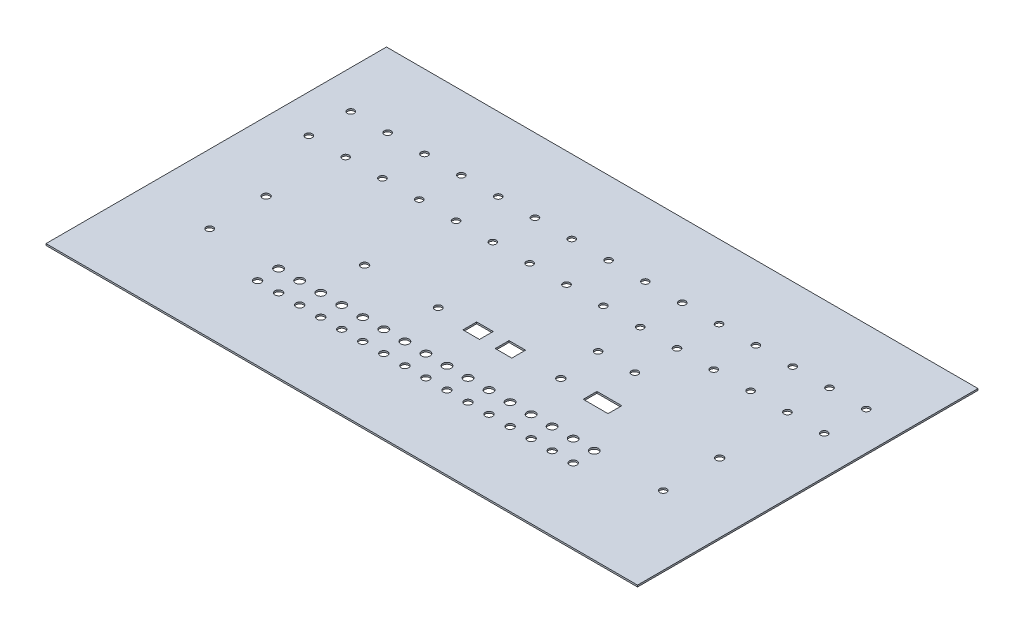
from build123d import *

# Parameters (mm, degrees)
SKETCH1_W            = 562.3
SKETCH1_H            = 323.65
BOSS_EXTRUDE1_DEPTH  = 1.5875
CUT_EXTRUDE1_REACH   = 326.4
SKETCH2_R            = 3.25
LPATTERN1_COUNT      = 15
LPATTERN1_PITCH      = 35
LPATTERN1_COUNT_DIR2 = 2
LPATTERN1_PITCH_DIR2 = 40
CUT_EXTRUDE2_REACH   = 326.4
SKETCH6_R            = 3.5
LPATTERN2_COUNT      = 16
LPATTERN2_PITCH      = 20
CUT_EXTRUDE3_REACH   = 326.4
SKETCH7_R            = 4
LPATTERN3_COUNT      = 16
LPATTERN3_PITCH      = 20
CUT_EXTRUDE4_REACH   = 326.4
SKETCH8_R            = 3.3
CUT_EXTRUDE5_REACH   = 326.4
SKETCH10_R           = 3.25
CUT_EXTRUDE6_REACH   = 326.4
SKETCH11_R           = 3.5
CUT_EXTRUDE7_REACH   = 326.4
SKETCH15_W           = 23.61
SKETCH15_H           = 13.08
CUT_EXTRUDE8_REACH   = 326.4
SKETCH16_R           = 3.3
CUT_EXTRUDE9_REACH   = 326.4
SKETCH18_W           = 15.74
SKETCH18_H           = 13.08
CUT_EXTRUDE10_REACH  = 326.4
SKETCH19_W           = 15.74
SKETCH19_H           = 13.08
CUT_EXTRUDE11_REACH  = 326.4
SKETCH22_R           = 3.5
CUT_EXTRUDE12_REACH  = 326.4
SKETCH24_R           = 3.5
CUT_EXTRUDE13_REACH  = 326.4
SKETCH26_R           = 3.5
CUT_EXTRUDE14_REACH  = 326.4
SKETCH28_R           = 3.25
CUT_EXTRUDE15_REACH  = 326.4
SKETCH29_R           = 3.25


with BuildPart() as part:
    # Sketch1 → Boss-Extrude1 (new body)
    with BuildSketch(Plane(origin=(0, 0, 0), x_dir=(1, 0, 0), z_dir=(0, 1, 0))):
        Rectangle(SKETCH1_W, SKETCH1_H)
    extrude(amount=BOSS_EXTRUDE1_DEPTH)

    # Sketch2 → Cut-Extrude1 (cut, up to next)
    with BuildSketch(Plane(origin=(0, 1.5875, 0), x_dir=(1, 0, 0), z_dir=(0, 1, 0)), mode=Mode.PRIVATE) as cut_extrude1_sk1:
        with Locations((-245, 91.825)):
            Circle(SKETCH2_R)
    cut_extrude1_tool1 = extrude(cut_extrude1_sk1.sketch, amount=-CUT_EXTRUDE1_REACH, mode=Mode.PRIVATE) & part.part
    cut_extrude1 = cut_extrude1_tool1.solids().sort_by_distance((-245, 1.5875, -91.825))[0]
    add(cut_extrude1, mode=Mode.SUBTRACT)

    # LPattern1: Cut-Extrude1 15 × 2
    with Locations(*[(i * LPATTERN1_PITCH, 0, j * LPATTERN1_PITCH_DIR2) for i in range(LPATTERN1_COUNT) for j in range(LPATTERN1_COUNT_DIR2) if (i, j) != (0, 0)]):
        add(cut_extrude1, mode=Mode.SUBTRACT)

    # Sketch6 → Cut-Extrude2 (cut, up to next)
    with BuildSketch(Plane(origin=(0, 1.5875, 0), x_dir=(1, 0, 0), z_dir=(0, 1, 0)), mode=Mode.PRIVATE) as cut_extrude2_sk1:
        with Locations((-150, -91.825)):
            Circle(SKETCH6_R)
    cut_extrude2_tool1 = extrude(cut_extrude2_sk1.sketch, amount=-CUT_EXTRUDE2_REACH, mode=Mode.PRIVATE) & part.part
    cut_extrude2 = cut_extrude2_tool1.solids().sort_by_distance((-150, 1.5875, 91.825))[0]
    add(cut_extrude2, mode=Mode.SUBTRACT)

    # LPattern2: Cut-Extrude2 ×16
    with Locations(*[(i * LPATTERN2_PITCH, 0, 0) for i in range(1, LPATTERN2_COUNT)]):
        add(cut_extrude2, mode=Mode.SUBTRACT)

    # Sketch7 → Cut-Extrude3 (cut, up to next)
    with BuildSketch(Plane(origin=(0, 1.5875, 0), x_dir=(1, 0, 0), z_dir=(0, 1, 0)), mode=Mode.PRIVATE) as cut_extrude3_sk1:
        with Locations((-150, -71.825)):
            Circle(SKETCH7_R)
    cut_extrude3_tool1 = extrude(cut_extrude3_sk1.sketch, amount=-CUT_EXTRUDE3_REACH, mode=Mode.PRIVATE) & part.part
    cut_extrude3 = cut_extrude3_tool1.solids().sort_by_distance((-150, 1.5875, 71.825))[0]
    add(cut_extrude3, mode=Mode.SUBTRACT)

    # LPattern3: Cut-Extrude3 ×16
    with Locations(*[(i * LPATTERN3_PITCH, 0, 0) for i in range(1, LPATTERN3_COUNT)]):
        add(cut_extrude3, mode=Mode.SUBTRACT)

    # Sketch8 → Cut-Extrude4 (cut, up to next)
    with BuildSketch(Plane(origin=(0, 1.5875, 0), x_dir=(1, 0, 0), z_dir=(0, 1, 0)), mode=Mode.PRIVATE) as cut_extrude4_sk1:
        with Locations((-215.575, -71.825)):
            Circle(SKETCH8_R)
    cut_extrude4_tool1 = extrude(cut_extrude4_sk1.sketch, amount=-CUT_EXTRUDE4_REACH, mode=Mode.PRIVATE) & part.part
    add(cut_extrude4_tool1.solids().sort_by_distance((-215.575, 1.5875, 71.825))[0], mode=Mode.SUBTRACT)

    # Sketch10 → Cut-Extrude5 (cut, up to next)
    with BuildSketch(Plane(origin=(0, 1.5875, 0), x_dir=(1, 0, 0), z_dir=(0, 1, 0)), mode=Mode.PRIVATE) as cut_extrude5_sk1:
        with Locations((215.575, -71.825)):
            Circle(SKETCH10_R)
    cut_extrude5_tool1 = extrude(cut_extrude5_sk1.sketch, amount=-CUT_EXTRUDE5_REACH, mode=Mode.PRIVATE) & part.part
    add(cut_extrude5_tool1.solids().sort_by_distance((215.575, 1.5875, 71.825))[0], mode=Mode.SUBTRACT)

    # Sketch11 → Cut-Extrude6 (cut, up to next)
    with BuildSketch(Plane(origin=(0, 1.5875, 0), x_dir=(1, 0, 0), z_dir=(0, 1, 0)), mode=Mode.PRIVATE) as cut_extrude6_sk1:
        with Locations((74.594310772, -28.175)):
            Circle(SKETCH11_R)
    cut_extrude6_tool1 = extrude(cut_extrude6_sk1.sketch, amount=-CUT_EXTRUDE6_REACH, mode=Mode.PRIVATE) & part.part
    add(cut_extrude6_tool1.solids().sort_by_distance((74.594311, 1.5875, 28.175))[0], mode=Mode.SUBTRACT)

    # Sketch15 → Cut-Extrude7 (cut, up to next)
    with BuildSketch(Plane(origin=(0, 1.5875, 0), x_dir=(1, 0, 0), z_dir=(0, 1, 0)), mode=Mode.PRIVATE) as cut_extrude7_sk1:
        with Locations((114.202396417, -28.175)):
            Rectangle(SKETCH15_W, SKETCH15_H)
    cut_extrude7_tool1 = extrude(cut_extrude7_sk1.sketch, amount=-CUT_EXTRUDE7_REACH, mode=Mode.PRIVATE) & part.part
    add(cut_extrude7_tool1.solids().sort_by_distance((114.202396, 1.5875, 28.175))[0], mode=Mode.SUBTRACT)

    # Sketch16 → Cut-Extrude8 (cut, up to next)
    with BuildSketch(Plane(origin=(0, 1.5875, 0), x_dir=(1, 0, 0), z_dir=(0, 1, 0)), mode=Mode.PRIVATE) as cut_extrude8_sk1:
        with Locations((-41.952521652, -28.175)):
            Circle(SKETCH16_R)
    cut_extrude8_tool1 = extrude(cut_extrude8_sk1.sketch, amount=-CUT_EXTRUDE8_REACH, mode=Mode.PRIVATE) & part.part
    add(cut_extrude8_tool1.solids().sort_by_distance((-41.952522, 1.5875, 28.175))[0], mode=Mode.SUBTRACT)

    # Sketch18 → Cut-Extrude9 (cut, up to next)
    with BuildSketch(Plane(origin=(0, 1.5875, 0), x_dir=(1, 0, 0), z_dir=(0, 1, 0)), mode=Mode.PRIVATE) as cut_extrude9_sk1:
        with Locations((-4.082521652, -28.175)):
            Rectangle(SKETCH18_W, SKETCH18_H)
    cut_extrude9_tool1 = extrude(cut_extrude9_sk1.sketch, amount=-CUT_EXTRUDE9_REACH, mode=Mode.PRIVATE) & part.part
    add(cut_extrude9_tool1.solids().sort_by_distance((-4.082522, 1.5875, 28.175))[0], mode=Mode.SUBTRACT)

    # Sketch19 → Cut-Extrude10 (cut, up to next)
    with BuildSketch(Plane(origin=(0, 1.5875, 0), x_dir=(1, 0, 0), z_dir=(0, 1, 0)), mode=Mode.PRIVATE) as cut_extrude10_sk1:
        with Locations((26.657478348, -28.175)):
            Rectangle(SKETCH19_W, SKETCH19_H)
    cut_extrude10_tool1 = extrude(cut_extrude10_sk1.sketch, amount=-CUT_EXTRUDE10_REACH, mode=Mode.PRIVATE) & part.part
    add(cut_extrude10_tool1.solids().sort_by_distance((26.657478, 1.5875, 28.175))[0], mode=Mode.SUBTRACT)

    # Sketch22 → Cut-Extrude11 (cut, up to next)
    with BuildSketch(Plane(origin=(0, 1.5875, 0), x_dir=(1, 0, 0), z_dir=(0, 1, 0)), mode=Mode.PRIVATE) as cut_extrude11_sk1:
        with Locations((-111.952521652, -28.175)):
            Circle(SKETCH22_R)
    cut_extrude11_tool1 = extrude(cut_extrude11_sk1.sketch, amount=-CUT_EXTRUDE11_REACH, mode=Mode.PRIVATE) & part.part
    add(cut_extrude11_tool1.solids().sort_by_distance((-111.952522, 1.5875, 28.175))[0], mode=Mode.SUBTRACT)

    # Sketch24 → Cut-Extrude12 (cut, up to next)
    with BuildSketch(Plane(origin=(0, 1.5875, 0), x_dir=(1, 0, 0), z_dir=(0, 1, 0)), mode=Mode.PRIVATE) as cut_extrude12_sk1:
        with Locations((-215.57, -18.175)):
            Circle(SKETCH24_R)
    cut_extrude12_tool1 = extrude(cut_extrude12_sk1.sketch, amount=-CUT_EXTRUDE12_REACH, mode=Mode.PRIVATE) & part.part
    add(cut_extrude12_tool1.solids().sort_by_distance((-215.57, 1.5875, 18.175))[0], mode=Mode.SUBTRACT)

    # Sketch26 → Cut-Extrude13 (cut, up to next)
    with BuildSketch(Plane(origin=(0, 1.5875, 0), x_dir=(1, 0, 0), z_dir=(0, 1, 0)), mode=Mode.PRIVATE) as cut_extrude13_sk1:
        with Locations((215.57, -18.175)):
            Circle(SKETCH26_R)
    cut_extrude13_tool1 = extrude(cut_extrude13_sk1.sketch, amount=-CUT_EXTRUDE13_REACH, mode=Mode.PRIVATE) & part.part
    add(cut_extrude13_tool1.solids().sort_by_distance((215.57, 1.5875, 18.175))[0], mode=Mode.SUBTRACT)

    # Sketch28 → Cut-Extrude14 (cut, up to next)
    with BuildSketch(Plane(origin=(0, 1.5875, 0), x_dir=(1, 0, 0), z_dir=(0, 1, 0)), mode=Mode.PRIVATE) as cut_extrude14_sk1:
        with Locations((70, 11.825)):
            Circle(SKETCH28_R)
    cut_extrude14_tool1 = extrude(cut_extrude14_sk1.sketch, amount=-CUT_EXTRUDE14_REACH, mode=Mode.PRIVATE) & part.part
    add(cut_extrude14_tool1.solids().sort_by_distance((70, 1.5875, -11.825))[0], mode=Mode.SUBTRACT)

    # Sketch29 → Cut-Extrude15 (cut, up to next)
    with BuildSketch(Plane(origin=(0, 1.5875, 0), x_dir=(1, 0, 0), z_dir=(0, 1, 0)), mode=Mode.PRIVATE) as cut_extrude15_sk1:
        with Locations((105, 11.825)):
            Circle(SKETCH29_R)
    cut_extrude15_tool1 = extrude(cut_extrude15_sk1.sketch, amount=-CUT_EXTRUDE15_REACH, mode=Mode.PRIVATE) & part.part
    add(cut_extrude15_tool1.solids().sort_by_distance((105, 1.5875, -11.825))[0], mode=Mode.SUBTRACT)


solid = part.part
